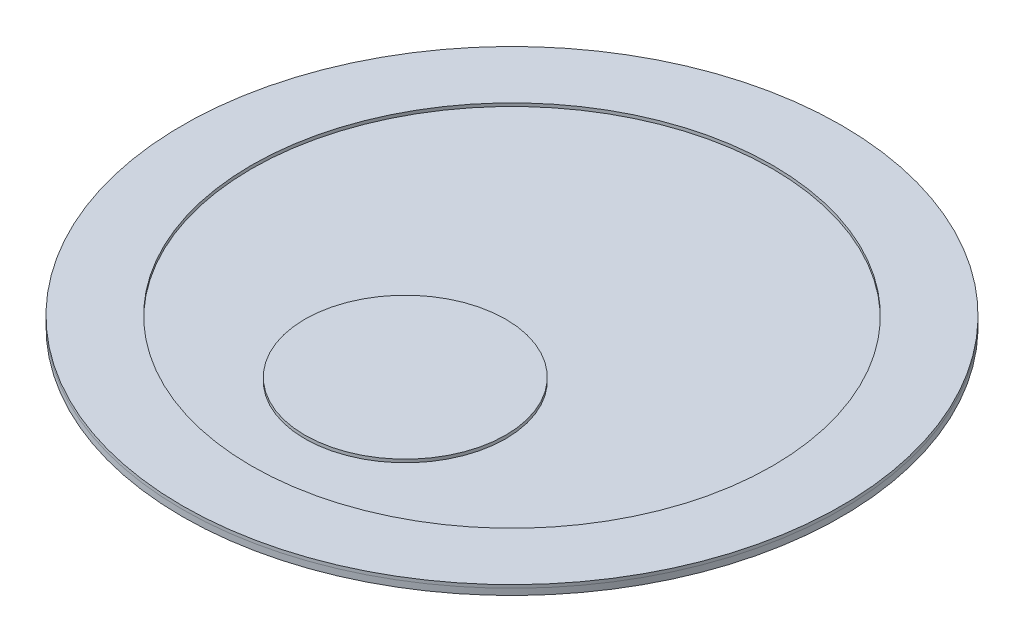
from build123d import *

# Parameters (mm, degrees)
SKETCH1_R             = 52.5
SKETCH1_R_2           = 41.5
BOSS_EXTRUDE1_DEPTH   = 0.5
SKETCH1_R_3           = 16
BOSS_EXTRUDE1_2_DEPTH = 0.5
BOSS_EXTRUDE2_START   = 1
SKETCH2_R             = 52.5
BOSS_EXTRUDE2_DEPTH   = 1


with BuildPart() as part:
    # Sketch1 → Boss-Extrude1 (new body)
    with BuildSketch(Plane(origin=(0, 0, 0), x_dir=(1, 0, 0), z_dir=(0, 1, 0))):
        Circle(SKETCH1_R)
        Circle(SKETCH1_R_2, mode=Mode.SUBTRACT)
    extrude(amount=BOSS_EXTRUDE1_DEPTH)


with BuildPart() as body_2:
    # Sketch1 → Boss-Extrude1 2 (new body)
    with BuildSketch(Plane(origin=(0, 0, 0), x_dir=(1, 0, 0), z_dir=(0, 1, 0))):
        with Locations((0, -17)):
            Circle(SKETCH1_R_3)
    extrude(amount=BOSS_EXTRUDE1_2_DEPTH)


with BuildPart() as body_3:
    # Sketch2 → Boss-Extrude2 (new body)
    with BuildSketch(Plane.XZ.offset(BOSS_EXTRUDE2_START)):
        Circle(SKETCH2_R)
    extrude(amount=-BOSS_EXTRUDE2_DEPTH)


solid = Compound([part.part, body_2.part, body_3.part])
